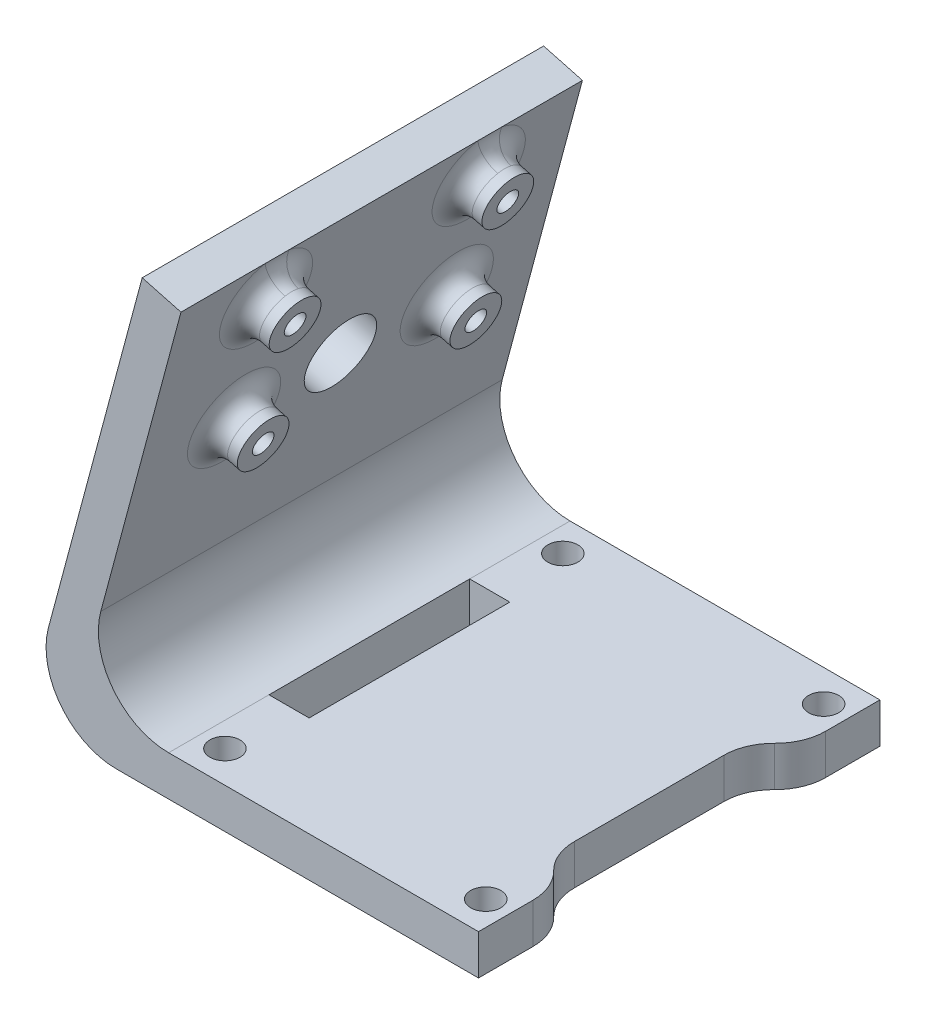
from build123d import *
from build123d.topology import SkipClean

# Parameters (mm, degrees)
ESTRUSIONE_ESTRUSIONE1_DEPTH = 40
RACCORDO1_R                  = 7
SCHIZZO2_W                   = 4
SCHIZZO2_H                   = 20
TAGLIO_ESTRUSIONE1_DEPTH     = 40
SCHIZZO3_R                   = 1.05
SCHIZZO3_R_2                 = 3.5
TAGLIO_ESTRUSIONE2_DEPTH     = 40
SCHIZZO4_R                   = 2.5
SCHIZZO4_R_2                 = 1.05
ESTRUSIONE_ESTRUSIONE2_DEPTH = 3
RACCORDO2_R                  = 2
SCHIZZO5_R                   = 1.5
TAGLIO_ESTRUSIONE3_DEPTH     = 17
TAGLIO_ESTRUSIONE4_DEPTH     = 10
RACCORDO3_R                  = 5
RACCORDO4_R                  = 5


with BuildPart() as part:
    # Schizzo1 → Estrusione-Estrusione1 (new body)
    with BuildSketch(Plane.XY):
        Polygon((0, 0), (-40, 0), (-29.647238196, 38.637033052), (-33.510941501, 39.672309232), (-45.212901491, -4), (0, -4), align=None)
    extrude(amount=ESTRUSIONE_ESTRUSIONE1_DEPTH)

    # Raccordo1
    raccordo1_edges = [part.edges().sort_by_distance(p)[0] for p in [
        (-45.212901491, -4, 20),
        (-40, 0, 20),
    ]]
    fillet(raccordo1_edges, radius=RACCORDO1_R)

    # Schizzo2 → Taglio-Estrusione1 (cut)
    with BuildSketch(Plane(origin=(0, 0, 0), x_dir=(1, 0, 0), z_dir=(0, 1, 0))):
        with Locations((-28.87742239, -20)):
            Rectangle(SCHIZZO2_W, SCHIZZO2_H)
    extrude(amount=-TAGLIO_ESTRUSIONE1_DEPTH, mode=Mode.SUBTRACT)

    # Schizzo3 → Taglio-Estrusione2 (cut)
    with BuildSketch(Plane(origin=(-41.184211381, 11.03527618, 0), x_dir=(0, 0, 1), z_dir=(-0.9659258262890673, 0.2588190451025247, 0))):
        with Locations(Location((30.402866557, 25.309568218, 0), (0, 0, 270))):
            Circle(SCHIZZO3_R)
        with Locations(Location((9.20859967, 25.309568218, 0), (0, 0, 270))):
            Circle(SCHIZZO3_R)
        with Locations(Location((30.402866557, 13.009568218, 0), (0, 0, 270))):
            Circle(SCHIZZO3_R)
        with Locations(Location((9.20859967, 13.009568218, 0), (0, 0, 270))):
            Circle(SCHIZZO3_R)
        with Locations(Location((19.902866557, 13.409568216, 0), (0, 0, 270))):
            Circle(SCHIZZO3_R_2)
    extrude(amount=-TAGLIO_ESTRUSIONE2_DEPTH, mode=Mode.SUBTRACT)

    # Schizzo4 → Estrusione-Estrusione2 (add)
    # profile 1 of 4: a face of its own
    with SkipClean():  # the faces are left unmerged after this step: merging them gives an invalid solid
        with BuildSketch(Plane(origin=(-37.320508076, 10, 0), x_dir=(0, 0, -1), z_dir=(0.9659258262890674, -0.2588190451025245, 0))):
            with Locations(Location((-9.20859967, 13.009568218, 0), (0, 0, 270))):
                Circle(SCHIZZO4_R)
            with Locations(Location((-9.20859967, 13.009568218, 0), (0, 0, 90))):
                Circle(SCHIZZO4_R_2, mode=Mode.SUBTRACT)
        # profile 2 of 4: a face of its own
        with BuildSketch(Plane(origin=(-37.320508076, 10, 0), x_dir=(0, 0, -1), z_dir=(0.9659258262890674, -0.2588190451025245, 0))):
            with Locations(Location((-30.402866557, 13.009568218, 0), (0, 0, 270))):
                Circle(SCHIZZO4_R)
            with Locations(Location((-30.402866557, 13.009568218, 0), (0, 0, 270))):
                Circle(SCHIZZO4_R_2, mode=Mode.SUBTRACT)
        # profile 3 of 4: a face of its own
        with BuildSketch(Plane(origin=(-37.320508076, 10, 0), x_dir=(0, 0, -1), z_dir=(0.9659258262890674, -0.2588190451025245, 0))):
            with Locations(Location((-30.402866557, 25.309568218, 0), (0, 0, 270))):
                Circle(SCHIZZO4_R)
            with Locations(Location((-30.402866557, 25.309568218, 0), (0, 0, 270))):
                Circle(SCHIZZO4_R_2, mode=Mode.SUBTRACT)
        # profile 4 of 4: a face of its own
        with BuildSketch(Plane(origin=(-37.320508076, 10, 0), x_dir=(0, 0, -1), z_dir=(0.9659258262890674, -0.2588190451025245, 0))):
            with Locations(Location((-9.20859967, 25.309568218, 0), (0, 0, 270))):
                Circle(SCHIZZO4_R)
            with Locations(Location((-9.20859967, 25.309568218, 0), (0, 0, 90))):
                Circle(SCHIZZO4_R_2, mode=Mode.SUBTRACT)
        extrude(amount=ESTRUSIONE_ESTRUSIONE2_DEPTH)
    add(part.part.scale(1), mode=Mode.REPLACE)  # the faces are merged on a copy

    # Raccordo2
    raccordo2_edges = [part.edges().sort_by_distance(p)[0] for p in [
        (-33.306336439, 24.981092497, 9.20859967),
        (-33.306336439, 24.981092497, 30.402866557),
        (-30.122862185, 36.86198016, 30.402866557),
        (-30.122862185, 36.86198016, 9.20859967),
    ]]
    fillet(raccordo2_edges, radius=RACCORDO2_R)

    # Schizzo5 → Taglio-Estrusione3 (cut)
    with BuildSketch(Plane(origin=(0, 0, 0), x_dir=(1, 0, 0), z_dir=(0, 1, 0))):
        with Locations(Location((-2.444220089, -36.8336475, 0), (0, 0, 180))):
            Circle(SCHIZZO5_R)
        with Locations(Location((-2.444220089, -3.1663525, 0), (0, 0, 180))):
            Circle(SCHIZZO5_R)
        with Locations(Location((-28.433202301, -3.1663525, 0), (0, 0, 180))):
            Circle(SCHIZZO5_R)
        with Locations(Location((-28.433202301, -36.8336475, 0), (0, 0, 180))):
            Circle(SCHIZZO5_R)
    extrude(amount=-TAGLIO_ESTRUSIONE3_DEPTH, mode=Mode.SUBTRACT)

    # Schizzo6 → Taglio-Estrusione4 (cut)
    with BuildSketch(Plane(origin=(0, 0, 0), x_dir=(1, 0, 0), z_dir=(0, 1, 0))):
        Polygon((0, -20), (0, -30), (-3, -30), (-3, -10), (0, -10), align=None)
    extrude(amount=-TAGLIO_ESTRUSIONE4_DEPTH, mode=Mode.SUBTRACT)

    # Raccordo3
    # the kernel refuses this fillet: 5 mm, written as the material it takes off along each edge
    with BuildSketch(Plane(origin=(0, 11.456439237, 10), x_dir=(0, 0, -1), z_dir=(0, -1, 0))) as raccordo3_piece_1:
        with BuildLine():
            CenterArc((4.582575695, -5), RACCORDO3_R, 90, 66.421821522)
            Line((0, -3), (-0.091651514, -2.96))
            ThreePointArc((-0.091651514, -2.96), (-0.1, -1.5), (-0.1, 0))
            Line((-0.1, 0), (0, 0.1))
            Line((0, 0.1), (4.582575695, 0.1))
            Line((4.582575695, 0.1), (4.582575695, 0))
        make_face()
    extrude(amount=26.912878475, mode=Mode.SUBTRACT)
    with BuildSketch(Plane(origin=(0, 11.456439237, 30), x_dir=(0, 0, 1), z_dir=(0, -1, 0))) as raccordo3_piece_2:
        with BuildLine():
            CenterArc((4.582575695, 5), RACCORDO3_R, 203.578178478, 66.421821522)
            Line((0, 3), (-0.091651514, 2.96))
            ThreePointArc((-0.091651514, 2.96), (-0.1, 1.5), (-0.1, 0))
            Line((-0.1, 0), (0, -0.1))
            Line((0, -0.1), (4.582575695, -0.1))
            Line((4.582575695, -0.1), (4.582575695, 0))
        make_face()
    extrude(amount=26.912878475, mode=Mode.SUBTRACT)

    # Raccordo4
    raccordo4_edges = [part.edges().sort_by_distance(p)[0] for p in [
        (-3, -2, 30),
        (-3, -2, 10),
    ]]
    fillet(raccordo4_edges, radius=RACCORDO4_R)


solid = part.part
